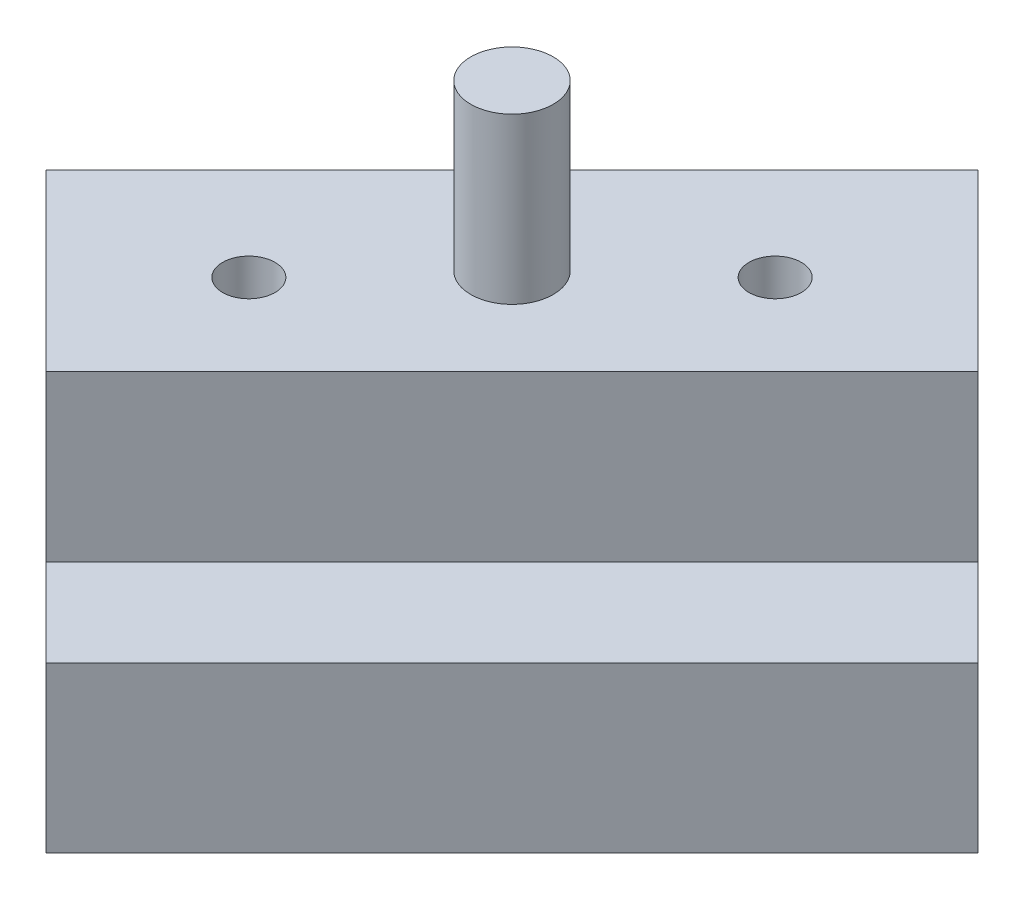
from build123d import *

# Parameters (mm, degrees)
BOSS_EXTRUDE1_DEPTH    = 25.4
F_10_32_TAPPED_HOLE1_D = 4.0386
SKETCH21_R             = 3.175
BOSS_EXTRUDE2_DEPTH    = 12.7
BODY_MOVE_COPY1_ANGLE  = 45


with BuildPart() as part:
    # Sketch1 → Boss-Extrude1 (new, symmetric)
    with BuildSketch(Plane(origin=(0, 0, 0), x_dir=(0, 0, -1), z_dir=(1, 0, 0))):
        Polygon((145.526233777, 211.483659956), (155.051233777, 211.483659956), (155.051233777, 224.183659956), (174.101233777, 224.183659956), (174.101233777, 198.783659956), (145.526233777, 198.783659956), align=None)
    extrude(amount=BOSS_EXTRUDE1_DEPTH, both=True)

    # #10-32 Tapped Hole1 (through all)
    with Locations(Plane(origin=(0, 224.183659956, 0), x_dir=(1, 0, 0), z_dir=(0, 1, 0))):
        with Locations((-14.343763893, 163.94997152), (14.343763893, 163.94997152)):
            Hole(F_10_32_TAPPED_HOLE1_D / 2)

    # Sketch21 → Boss-Extrude2 (add)
    with BuildSketch(Plane(origin=(0, 224.183659956, 0), x_dir=(1, 0, 0), z_dir=(0, 1, 0))):
        with Locations((0, 164.576233777)):
            Circle(SKETCH21_R)
    extrude(amount=BOSS_EXTRUDE2_DEPTH)


with BuildPart() as part_1:
    # Body-Move/Copy1: moved
    add(part.part.rotate(Axis((0, 0, 0), (0, 1, 0)), BODY_MOVE_COPY1_ANGLE))


solid = part_1.part
